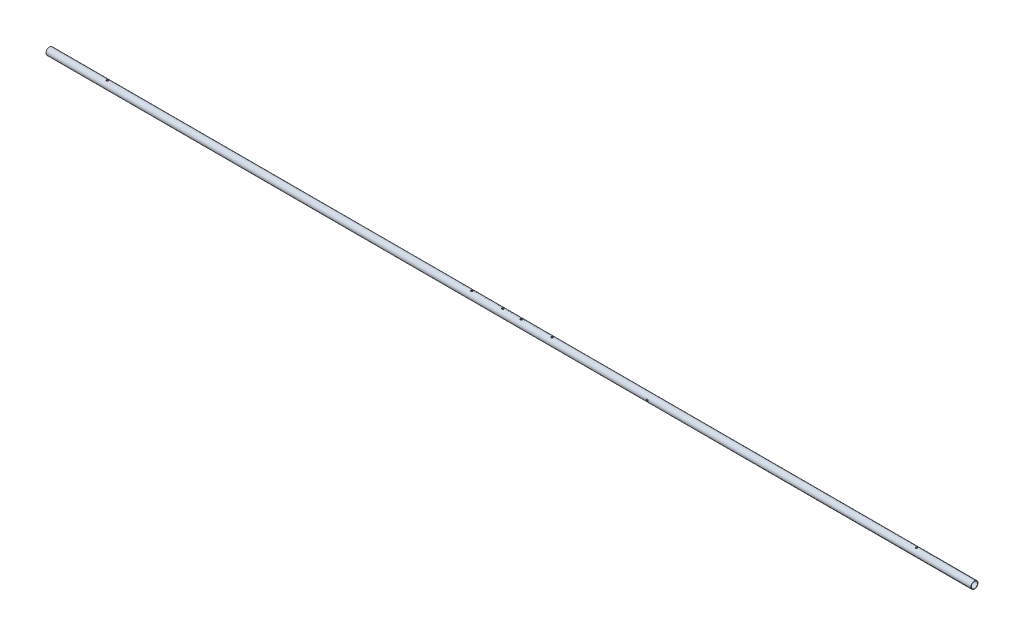
from build123d import *

# Parameters (mm, degrees)
SKETCH3_R               = 11.7094
SKETCH3_R_2             = 10.4648
BOSS_EXTRUDE1_DEPTH     = 3048
CUT_EXTRUDE1_DEPTH      = 3049.04498328
CUT_EXTRUDE1_DEPTH_BACK = 3049.04498328
SKETCH4_R               = 3.175
CUT_EXTRUDE2_DEPTH      = 3049.04498338
CUT_EXTRUDE2_DEPTH_BACK = 3049.04498338
SKETCH5_R               = 3.175
CUT_EXTRUDE3_DEPTH      = 3049.04498338
CUT_EXTRUDE3_DEPTH_BACK = 3049.04498338
SKETCH7_R               = 3.175


with BuildPart() as part:
    # Sketch3 → Boss-Extrude1 (new body)
    with BuildSketch(Plane(origin=(0, 0, 0), x_dir=(0, 0, -1), z_dir=(1, 0, 0))):
        Circle(SKETCH3_R)
        Circle(SKETCH3_R_2, mode=Mode.SUBTRACT)
    extrude(amount=BOSS_EXTRUDE1_DEPTH)

    # Sketch4 → Cut-Extrude1 (cut, two sides: drawn at the far end of the back side and taken through both)
    with BuildSketch(Plane(origin=(0, 0, 0), x_dir=(1, 0, 0), z_dir=(0, 1, 0)).offset(-CUT_EXTRUDE1_DEPTH_BACK)):
        with Locations((1493.52, 0)):
            Circle(SKETCH4_R)
        with Locations((1554.48, 0)):
            Circle(SKETCH4_R)
        with Locations((1656.1816, 0)):
            Circle(SKETCH4_R)
        with Locations((1391.8184, 0)):
            Circle(SKETCH4_R)
    extrude(amount=CUT_EXTRUDE1_DEPTH + CUT_EXTRUDE1_DEPTH_BACK, mode=Mode.SUBTRACT)

    # Sketch5 → Cut-Extrude2 (cut, two sides: drawn at the far end of the back side and taken through both)
    with BuildSketch(Plane(origin=(0, 0, 0), x_dir=(1, 0, 0), z_dir=(0, 1, 0)).offset(-CUT_EXTRUDE2_DEPTH_BACK)):
        with Locations((190.5, 0)):
            Circle(SKETCH5_R)
        with Locations((2857.5, 0)):
            Circle(SKETCH5_R)
    extrude(amount=CUT_EXTRUDE2_DEPTH + CUT_EXTRUDE2_DEPTH_BACK, mode=Mode.SUBTRACT)

    # Sketch7 → Cut-Extrude3 (cut, two sides: drawn at the far end of the back side and taken through both)
    with BuildSketch(Plane.XY.offset(-CUT_EXTRUDE3_DEPTH_BACK)):
        with Locations((1981.2, 0)):
            Circle(SKETCH7_R)
    extrude(amount=CUT_EXTRUDE3_DEPTH + CUT_EXTRUDE3_DEPTH_BACK, mode=Mode.SUBTRACT)


solid = part.part
